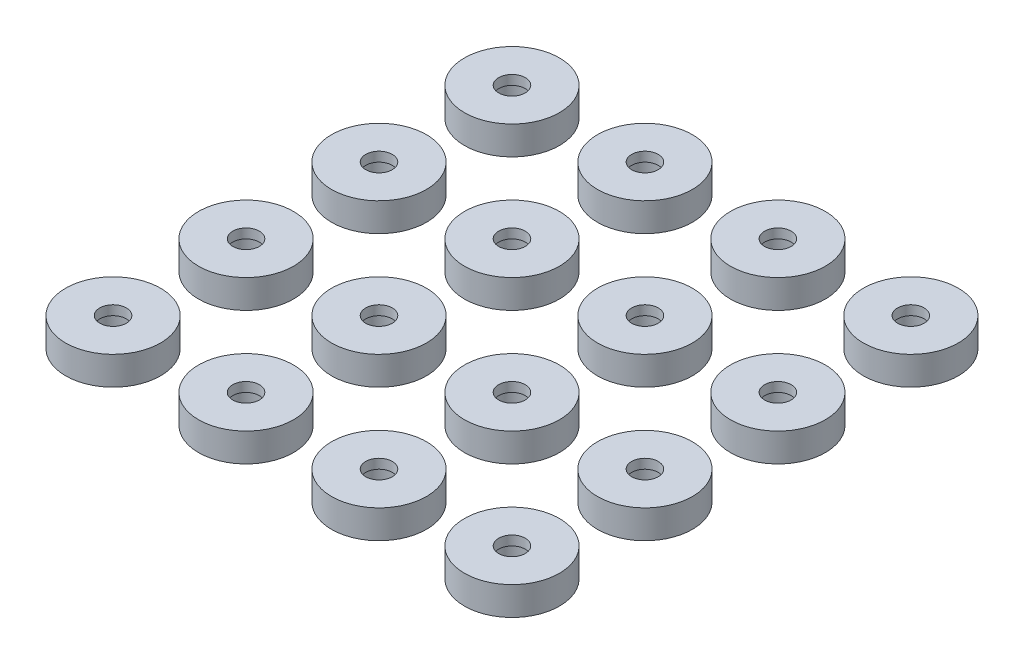
from build123d import *

# Parameters (mm, degrees)
SKETCH_1_R             = 2.5
EXTRUDE_1_DEPTH        = 1.5
SKETCH_1_5_R           = 1
CUT_EXTRUDE_2_DEPTH    = 1
SKETCH_1_6_R           = 0.7
CUT_EXTRUDE_3_DEPTH    = 4.840572874
PATTERN_LINEAR_1_COUNT = 4
PATTERN_LINEAR_1_PITCH = 7
PATTERN_LINEAR_2_COUNT = 4
PATTERN_LINEAR_2_PITCH = 7


with BuildPart() as part:
    # 草图1 → 凸台-拉伸1 (new body)
    with BuildSketch(Plane(origin=(0, 0, 0), x_dir=(1, 0, 0), z_dir=(0, 1, 0))):
        Circle(SKETCH_1_R)
    extrude(amount=EXTRUDE_1_DEPTH)

    # 草图1<5> → 切除-拉伸2 (cut)
    with BuildSketch(Plane(origin=(0, 0, 0), x_dir=(1, 0, 0), z_dir=(0, 1, 0))):
        Circle(SKETCH_1_5_R)
    extrude(amount=CUT_EXTRUDE_2_DEPTH, mode=Mode.SUBTRACT)

    # 草图1<6> → 切除-拉伸3 (cut, through all)
    with BuildSketch(Plane(origin=(0, 0, 0), x_dir=(1, 0, 0), z_dir=(0, 1, 0))):
        Circle(SKETCH_1_6_R)
    extrude(amount=CUT_EXTRUDE_3_DEPTH, mode=Mode.SUBTRACT)


with BuildPart() as pattern_linear_1_1:
    # 阵列(线性)1: pattern copy
    add(part.part.moved(Location(Vector(0, 0, 1) * (1 * PATTERN_LINEAR_1_PITCH))))


with BuildPart() as pattern_linear_1_2:
    # 阵列(线性)1: pattern copy
    add(part.part.moved(Location(Vector(0, 0, 1) * (2 * PATTERN_LINEAR_1_PITCH))))


with BuildPart() as pattern_linear_1_3:
    # 阵列(线性)1: pattern copy
    add(part.part.moved(Location(Vector(0, 0, 1) * (3 * PATTERN_LINEAR_1_PITCH))))


with BuildPart() as pattern_linear_2_1:
    # 阵列(线性)2: pattern copy
    add(pattern_linear_1_3.part.moved(Location(Vector(1, 0, 0) * (1 * PATTERN_LINEAR_2_PITCH))))


with BuildPart() as pattern_linear_2_2:
    # 阵列(线性)2: pattern copy
    add(pattern_linear_1_3.part.moved(Location(Vector(1, 0, 0) * (2 * PATTERN_LINEAR_2_PITCH))))


with BuildPart() as pattern_linear_2_3:
    # 阵列(线性)2: pattern copy
    add(pattern_linear_1_3.part.moved(Location(Vector(1, 0, 0) * (3 * PATTERN_LINEAR_2_PITCH))))


with BuildPart() as pattern_linear_2_4:
    # 阵列(线性)2: pattern copy
    add(part.part.moved(Location(Vector(1, 0, 0) * (1 * PATTERN_LINEAR_2_PITCH))))


with BuildPart() as pattern_linear_2_5:
    # 阵列(线性)2: pattern copy
    add(part.part.moved(Location(Vector(1, 0, 0) * (2 * PATTERN_LINEAR_2_PITCH))))


with BuildPart() as pattern_linear_2_6:
    # 阵列(线性)2: pattern copy
    add(part.part.moved(Location(Vector(1, 0, 0) * (3 * PATTERN_LINEAR_2_PITCH))))


with BuildPart() as pattern_linear_2_7:
    # 阵列(线性)2: pattern copy
    add(pattern_linear_1_1.part.moved(Location(Vector(1, 0, 0) * (1 * PATTERN_LINEAR_2_PITCH))))


with BuildPart() as pattern_linear_2_8:
    # 阵列(线性)2: pattern copy
    add(pattern_linear_1_1.part.moved(Location(Vector(1, 0, 0) * (2 * PATTERN_LINEAR_2_PITCH))))


with BuildPart() as pattern_linear_2_9:
    # 阵列(线性)2: pattern copy
    add(pattern_linear_1_1.part.moved(Location(Vector(1, 0, 0) * (3 * PATTERN_LINEAR_2_PITCH))))


with BuildPart() as pattern_linear_2_10:
    # 阵列(线性)2: pattern copy
    add(pattern_linear_1_2.part.moved(Location(Vector(1, 0, 0) * (1 * PATTERN_LINEAR_2_PITCH))))


with BuildPart() as pattern_linear_2_11:
    # 阵列(线性)2: pattern copy
    add(pattern_linear_1_2.part.moved(Location(Vector(1, 0, 0) * (2 * PATTERN_LINEAR_2_PITCH))))


with BuildPart() as pattern_linear_2_12:
    # 阵列(线性)2: pattern copy
    add(pattern_linear_1_2.part.moved(Location(Vector(1, 0, 0) * (3 * PATTERN_LINEAR_2_PITCH))))


solid = Compound([part.part, pattern_linear_1_1.part, pattern_linear_1_2.part, pattern_linear_1_3.part, pattern_linear_2_1.part, pattern_linear_2_2.part, pattern_linear_2_3.part, pattern_linear_2_4.part, pattern_linear_2_5.part, pattern_linear_2_6.part, pattern_linear_2_7.part, pattern_linear_2_8.part, pattern_linear_2_9.part, pattern_linear_2_10.part, pattern_linear_2_11.part, pattern_linear_2_12.part])
